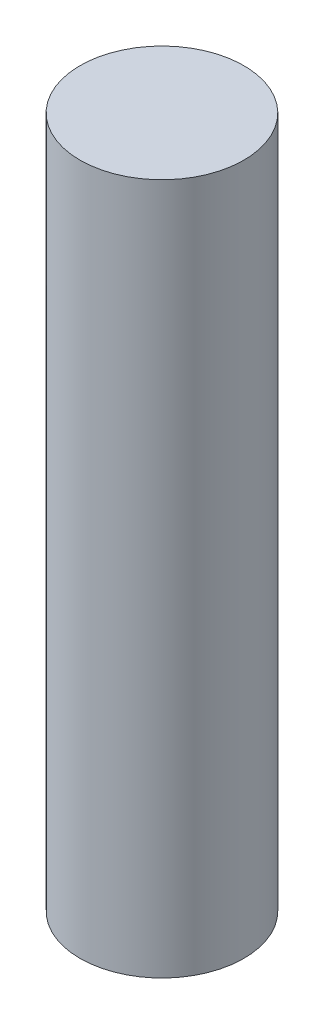
from build123d import *

# Parameters (mm, degrees)
SKETCH1_R           = 11.85
BOSS_EXTRUDE1_DEPTH = 100


with BuildPart() as part:
    # Sketch1 → Boss-Extrude1 (new body)
    with BuildSketch(Plane(origin=(0, 0, 0), x_dir=(1, 0, 0), z_dir=(0, 1, 0))):
        Circle(SKETCH1_R)
    extrude(amount=BOSS_EXTRUDE1_DEPTH)


solid = part.part
